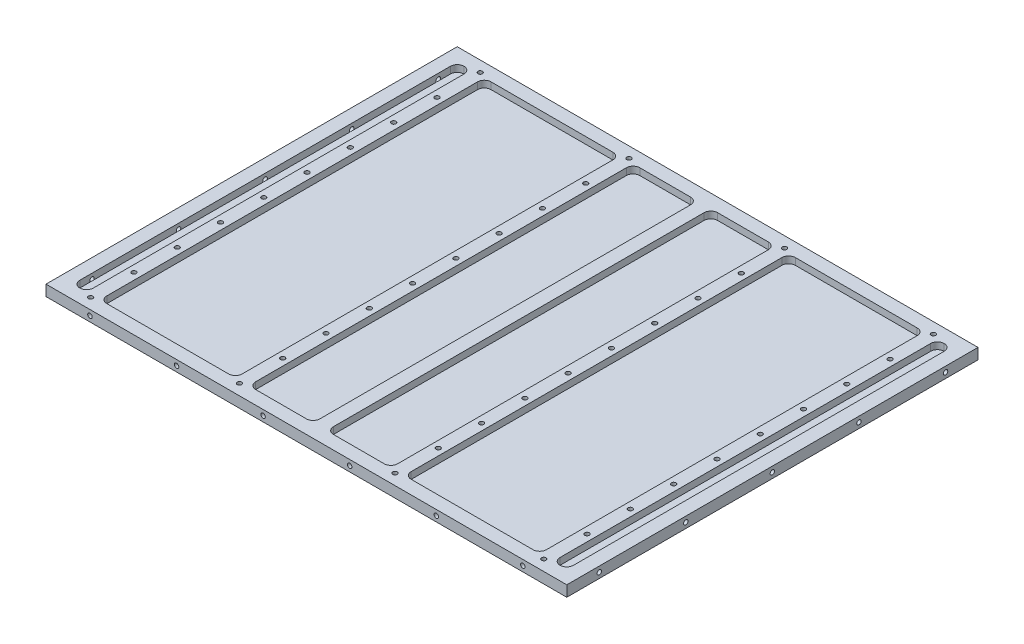
from build123d import *

# Parameters (mm, degrees)
SKETCH1_W           = 385
SKETCH1_H           = 304
EXTRUDE1_DEPTH      = 8
SKETCH2_R           = 1.65
CUT_EXTRUDE1_DEPTH  = 9.5
SKETCH3_R           = 1.65
CUT_EXTRUDE2_DEPTH  = 10
SKETCH4_W           = 365
SKETCH4_H           = 284
CUT_EXTRUDE3_DEPTH  = 5
SKETCH5_W           = 10
SKETCH5_H           = 284
BOSS_EXTRUDE1_DEPTH = 5
SKETCH6_W           = 10
SKETCH6_H           = 284
BOSS_EXTRUDE2_DEPTH = 5
SKETCH7_R           = 1.65
CUT_EXTRUDE4_DEPTH  = 10
MIRROR3_OUTLINE_R   = 1.65
MIRROR3_DEPTH       = 8
MIRROR3_START       = 3
MIRROR3_2_OUTLINE_W = 10
MIRROR3_2_OUTLINE_H = 284
MIRROR3_2_OUTLINE_R = 1.65
MIRROR3_2_DEPTH     = 5
FILLET1_R           = 5


# Read off the part's stored shape, not the designer's step: Mirror3
with BuildPart() as part:
    # Sketch1 → Extrude1 (new body)
    with BuildSketch(Plane(origin=(0, 0, 0), x_dir=(1, 0, 0), z_dir=(0, 1, 0))):
        Rectangle(SKETCH1_W, SKETCH1_H)
    extrude(amount=EXTRUDE1_DEPTH)

    # Sketch2 → Cut-Extrude1 (cut)
    with BuildSketch(Plane.XY.offset(152)):
        with Locations((-160, 4)):
            Circle(SKETCH2_R)
        with Locations((-96, 4)):
            Circle(SKETCH2_R)
        with Locations((-32, 4)):
            Circle(SKETCH2_R)
        with Locations((32, 4)):
            Circle(SKETCH2_R)
        with Locations((96, 4)):
            Circle(SKETCH2_R)
        with Locations((160, 4)):
            Circle(SKETCH2_R)
    cut_extrude1 = extrude(amount=-CUT_EXTRUDE1_DEPTH, mode=Mode.SUBTRACT)

    # Mirror1: Cut-Extrude1 across plane
    add(cut_extrude1.mirror(Plane.XY), mode=Mode.SUBTRACT)

    # Sketch3 → Cut-Extrude2 (cut)
    with BuildSketch(Plane.ZY.offset(192.5)):
        with Locations((-128, 4)):
            Circle(SKETCH3_R)
        with Locations((-64, 4)):
            Circle(SKETCH3_R)
        with Locations((0, 4)):
            Circle(SKETCH3_R)
        with Locations((64, 4)):
            Circle(SKETCH3_R)
        with Locations((128, 4)):
            Circle(SKETCH3_R)
    cut_extrude2 = extrude(amount=-CUT_EXTRUDE2_DEPTH, mode=Mode.SUBTRACT)

    # Mirror2: Cut-Extrude2 across plane
    add(cut_extrude2.mirror(Plane(origin=(0, 0, 0), x_dir=(0, 0, 1), z_dir=(1, 0, 0))), mode=Mode.SUBTRACT)

    # Sketch4 → Cut-Extrude3 (cut)
    with BuildSketch(Plane(origin=(0, 8, 0), x_dir=(-1, 0, 0), z_dir=(0, 1, 0))):
        Rectangle(SKETCH4_W, SKETCH4_H)
    extrude(amount=-CUT_EXTRUDE3_DEPTH, mode=Mode.SUBTRACT)

    # Sketch5 → Boss-Extrude1 (add)
    with BuildSketch(Plane(origin=(0, 3, 0), x_dir=(1, 0, 0), z_dir=(0, 1, 0))):
        with Locations((-167.5, 0)):
            Rectangle(SKETCH5_W, SKETCH5_H)
        with Locations((167.5, 0)):
            Rectangle(SKETCH5_W, SKETCH5_H)
    boss_extrude1 = extrude(amount=BOSS_EXTRUDE1_DEPTH)

    # Sketch6 → Boss-Extrude2 (add)
    with BuildSketch(Plane(origin=(0, 3, 0), x_dir=(1, 0, 0), z_dir=(0, 1, 0))):
        Rectangle(SKETCH6_W, SKETCH6_H)
    extrude(amount=BOSS_EXTRUDE2_DEPTH)

    # Sketch7 → Cut-Extrude4 (cut)
    with BuildSketch(Plane(origin=(0, 8, 0), x_dir=(1, 0, 0), z_dir=(0, 1, 0))):
        with Locations(Location((-167.5, -112, 0), (0, 0, 270))):
            Circle(SKETCH7_R)
        with Locations(Location((-167.5, -80, 0), (0, 0, 270))):
            Circle(SKETCH7_R)
        with Locations(Location((-167.5, -48, 0), (0, 0, 270))):
            Circle(SKETCH7_R)
        with Locations(Location((-167.5, -16, 0), (0, 0, 270))):
            Circle(SKETCH7_R)
        with Locations(Location((-167.5, 16, 0), (0, 0, 270))):
            Circle(SKETCH7_R)
        with Locations(Location((-167.5, 48, 0), (0, 0, 270))):
            Circle(SKETCH7_R)
        with Locations(Location((-167.5, 80, 0), (0, 0, 270))):
            Circle(SKETCH7_R)
        with Locations(Location((-167.5, 112, 0), (0, 0, 270))):
            Circle(SKETCH7_R)
        with Locations(Location((167.5, 112, 0), (0, 0, 270))):
            Circle(SKETCH7_R)
        with Locations(Location((167.5, 80, 0), (0, 0, 270))):
            Circle(SKETCH7_R)
        with Locations(Location((167.5, 48, 0), (0, 0, 270))):
            Circle(SKETCH7_R)
        with Locations(Location((167.5, 16, 0), (0, 0, 270))):
            Circle(SKETCH7_R)
        with Locations(Location((167.5, -16, 0), (0, 0, 270))):
            Circle(SKETCH7_R)
        with Locations(Location((167.5, -48, 0), (0, 0, 270))):
            Circle(SKETCH7_R)
        with Locations(Location((167.5, -80, 0), (0, 0, 270))):
            Circle(SKETCH7_R)
        with Locations(Location((167.5, -112, 0), (0, 0, 270))):
            Circle(SKETCH7_R)
        with Locations(Location((-167.5, 144, 0), (0, 0, 270))):
            Circle(SKETCH7_R)
        with Locations(Location((-167.5, -144, 0), (0, 0, 270))):
            Circle(SKETCH7_R)
        with Locations(Location((167.5, -144, 0), (0, 0, 270))):
            Circle(SKETCH7_R)
        with Locations(Location((167.5, 144, 0), (0, 0, 270))):
            Circle(SKETCH7_R)
    cut_extrude4 = extrude(amount=-CUT_EXTRUDE4_DEPTH, mode=Mode.SUBTRACT)

    # Mirror3 outline → Mirror3 (cut)
    with BuildSketch(Plane(origin=(0, 0, 0), x_dir=(1, 0, 0), z_dir=(0, 1, 0))):
        with Locations((-57.5, -112)):
            Circle(MIRROR3_OUTLINE_R)
        with Locations((-57.5, -80)):
            Circle(MIRROR3_OUTLINE_R)
        with Locations((-57.5, -48)):
            Circle(MIRROR3_OUTLINE_R)
        with Locations((-57.5, -16)):
            Circle(MIRROR3_OUTLINE_R)
        with Locations((-57.5, 16)):
            Circle(MIRROR3_OUTLINE_R)
        with Locations((-57.5, 48)):
            Circle(MIRROR3_OUTLINE_R)
        with Locations((-57.5, 80)):
            Circle(MIRROR3_OUTLINE_R)
        with Locations((-57.5, 112)):
            Circle(MIRROR3_OUTLINE_R)
        with Locations((-57.5, 144)):
            Circle(MIRROR3_OUTLINE_R)
        with Locations((-57.5, -144)):
            Circle(MIRROR3_OUTLINE_R)
    mirror3 = extrude(amount=MIRROR3_DEPTH, mode=Mode.SUBTRACT)

    # Mirror3 2 outline → Mirror3 2 (add)
    with BuildSketch(Plane(origin=(0, 0, 0), x_dir=(1, 0, 0), z_dir=(0, 1, 0)).offset(MIRROR3_START)):
        with Locations((-57.5, 0)):
            Rectangle(MIRROR3_2_OUTLINE_W, MIRROR3_2_OUTLINE_H)
        with Locations((-57.5, -112)):
            Circle(MIRROR3_2_OUTLINE_R, mode=Mode.SUBTRACT)
        with Locations((-57.5, -80)):
            Circle(MIRROR3_2_OUTLINE_R, mode=Mode.SUBTRACT)
        with Locations((-57.5, -48)):
            Circle(MIRROR3_2_OUTLINE_R, mode=Mode.SUBTRACT)
        with Locations((-57.5, -16)):
            Circle(MIRROR3_2_OUTLINE_R, mode=Mode.SUBTRACT)
        with Locations((-57.5, 16)):
            Circle(MIRROR3_2_OUTLINE_R, mode=Mode.SUBTRACT)
        with Locations((-57.5, 48)):
            Circle(MIRROR3_2_OUTLINE_R, mode=Mode.SUBTRACT)
        with Locations((-57.5, 80)):
            Circle(MIRROR3_2_OUTLINE_R, mode=Mode.SUBTRACT)
        with Locations((-57.5, 112)):
            Circle(MIRROR3_2_OUTLINE_R, mode=Mode.SUBTRACT)
    mirror3_2 = extrude(amount=MIRROR3_2_DEPTH)

    # Mirror4: Boss-Extrude1, Cut-Extrude4, Mirror3, Mirror3 2 across plane
    add(boss_extrude1.mirror(Plane(origin=(0, 0, 0), x_dir=(0, 0, 1), z_dir=(1, 0, 0))))
    add(cut_extrude4.mirror(Plane(origin=(0, 0, 0), x_dir=(0, 0, 1), z_dir=(1, 0, 0))), mode=Mode.SUBTRACT)
    add(mirror3.mirror(Plane(origin=(0, 0, 0), x_dir=(0, 0, 1), z_dir=(1, 0, 0))), mode=Mode.SUBTRACT)
    add(mirror3_2.mirror(Plane(origin=(0, 0, 0), x_dir=(0, 0, 1), z_dir=(1, 0, 0))))

    # Fillet1
    fillet1_edges = [part.edges().sort_by_distance(p)[0] for p in [
        (182.5, 5.5, -142),
        (182.5, 5.5, 142),
        (-182.5, 5.5, 142),
        (-182.5, 5.5, -142),
        (-172.5, 5.5, -142),
        (-172.5, 5.5, 142),
        (-162.5, 5.5, 142),
        (-162.5, 5.5, -142),
        (172.5, 5.5, -142),
        (162.5, 5.5, -142),
        (162.5, 5.5, 142),
        (172.5, 5.5, 142),
        (-5, 5.5, -142),
        (-5, 5.5, 142),
        (5, 5.5, 142),
        (5, 5.5, -142),
        (-62.5, 5.5, 142),
        (-62.5, 5.5, -142),
        (-52.5, 5.5, -142),
        (-52.5, 5.5, 142),
        (52.5, 5.5, -142),
        (52.5, 5.5, 142),
        (62.5, 5.5, 142),
        (62.5, 5.5, -142),
    ]]
    fillet(fillet1_edges, radius=FILLET1_R - 0.0001)  # a hair under: the kernel refuses the full size


solid = part.part
